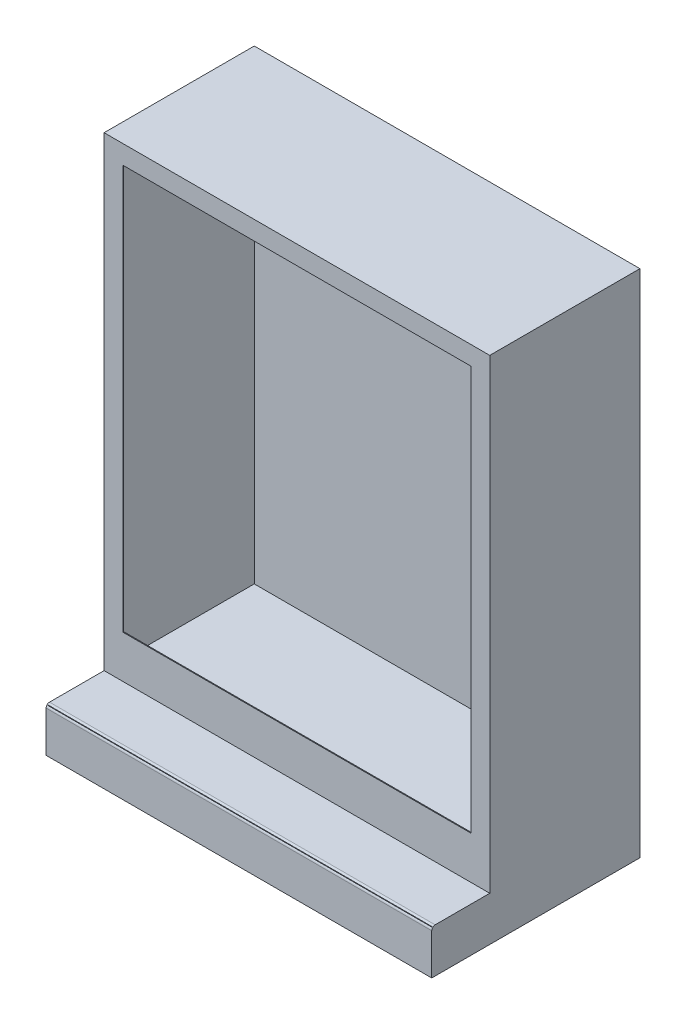
from build123d import *

# Parameters (mm, degrees)
SKETCH1_W           = 279.4
SKETCH1_H           = 866.775
BOSS_EXTRUDE1_DEPTH = 717.55
SHELL2_START        = 1.5875
SHELL2_OUTLINE_W    = 863.6
SHELL2_OUTLINE_H    = 276.225
SHELL2_DEPTH        = 714.375
SHELL2_START_2      = 34.925
SHELL2_2_OUTLINE_W  = 752.475
SHELL2_2_OUTLINE_H  = 1.5875
SHELL2_2_DEPTH      = 647.7
BOSS_EXTRUDE2_DEPTH = 717.55
SHELL3_START        = -385.7625
SHELL3_OUTLINE_W    = 714.375
SHELL3_OUTLINE_H    = 79.375
SHELL3_DEPTH        = 384.175
SHELL3_START_2      = -368.3
SHELL3_2_OUTLINE_W  = 714.375
SHELL3_2_OUTLINE_H  = 1.5875
SHELL3_2_DEPTH      = 258.7625
SHELL3_START_3      = -109.5375
SHELL3_3_OUTLINE_W  = 714.375
SHELL3_3_OUTLINE_H  = 1.5875
SHELL3_3_DEPTH      = 90.4875
SHELL3_4_OUTLINE_W  = 714.375
SHELL3_4_OUTLINE_H  = 1.5875
SHELL3_4_DEPTH      = 17.4625
FILLET1_R           = 6.35
SKETCH6_W           = 41.275
SKETCH6_H           = 387.35
BOSS_EXTRUDE3_DEPTH = 11.1125
SKETCH8_W           = 38.1
SKETCH8_H           = 384.175
CUT_EXTRUDE1_DEPTH  = 9.525
BOSS_EXTRUDE6_REACH = 1252.544


# Read off the part's stored shape, not the designer's step: Shell2, Shell3
with BuildPart() as part:
    # Sketch1 → Boss-Extrude1 (new body)
    with BuildSketch(Plane(origin=(0, 0, 0), x_dir=(0, 0, -1), z_dir=(1, 0, 0))):
        with Locations((247.65, 515.9375)):
            Rectangle(SKETCH1_W, SKETCH1_H)
    extrude(amount=BOSS_EXTRUDE1_DEPTH)

    # Shell2 outline → Shell2 (cut)
    with BuildSketch(Plane.YZ.offset(SHELL2_START)):
        with Locations((515.9375, -247.65)):
            Rectangle(SHELL2_OUTLINE_W, SHELL2_OUTLINE_H)
    extrude(amount=SHELL2_DEPTH, mode=Mode.SUBTRACT)

    # Shell2 2 outline → Shell2 2 (cut)
    with BuildSketch(Plane.YZ.offset(SHELL2_START_2)):
        with Locations((538.1625, -108.74375)):
            Rectangle(SHELL2_2_OUTLINE_W, SHELL2_2_OUTLINE_H)
    extrude(amount=SHELL2_2_DEPTH, mode=Mode.SUBTRACT)

    # Sketch4 → Boss-Extrude2 (add)
    with BuildSketch(Plane(origin=(0, 0, 0), x_dir=(0, 0, -1), z_dir=(1, 0, 0))):
        Polygon((0, 0), (0, 82.55), (107.95, 82.55), (387.35, 82.55), (387.35, 0), align=None)
    extrude(amount=BOSS_EXTRUDE2_DEPTH)

    # Shell3 outline → Shell3 (cut)
    with BuildSketch(Plane.XY.offset(SHELL3_START)):
        with Locations((358.775, 41.275)):
            Rectangle(SHELL3_OUTLINE_W, SHELL3_OUTLINE_H)
    extrude(amount=SHELL3_DEPTH, mode=Mode.SUBTRACT)

    # Shell3 2 outline → Shell3 2 (cut)
    with BuildSketch(Plane.XY.offset(SHELL3_START_2)):
        with Locations((358.775, 0.79375)):
            Rectangle(SHELL3_2_OUTLINE_W, SHELL3_2_OUTLINE_H)
        with Locations((358.775, 81.75625)):
            Rectangle(SHELL3_2_OUTLINE_W, SHELL3_2_OUTLINE_H)
    extrude(amount=SHELL3_2_DEPTH, mode=Mode.SUBTRACT)

    # Shell3 3 outline → Shell3 3 (cut)
    with BuildSketch(Plane.XY.offset(SHELL3_START_3)):
        with Locations((358.775, 0.79375)):
            Rectangle(SHELL3_3_OUTLINE_W, SHELL3_3_OUTLINE_H)
    extrude(amount=SHELL3_3_DEPTH, mode=Mode.SUBTRACT)

    # Shell3 4 outline → Shell3 4 (cut)
    with BuildSketch(Plane.XY.offset(SHELL3_START)):
        with Locations((358.775, 81.75625)):
            Rectangle(SHELL3_4_OUTLINE_W, SHELL3_4_OUTLINE_H)
    extrude(amount=SHELL3_4_DEPTH, mode=Mode.SUBTRACT)

    # Fillet1
    fillet1_edges = [part.edges().sort_by_distance(p)[0] for p in [
        (358.775, 82.55, 0),
    ]]
    fillet(fillet1_edges, radius=FILLET1_R)

    # Sketch6 → Boss-Extrude3 (add)
    with BuildSketch(Plane(origin=(0, 0, 0), x_dir=(1, 0, 0), z_dir=(0, 1, 0))):
        with Locations((123.825, 193.675)):
            Rectangle(SKETCH6_W, SKETCH6_H)
        with Locations((593.725, 193.675)):
            Rectangle(SKETCH6_W, SKETCH6_H)
    extrude(amount=BOSS_EXTRUDE3_DEPTH)

    # Sketch8 → Cut-Extrude1 (cut)
    with BuildSketch(Plane(origin=(0, 11.1125, 0), x_dir=(1, 0, 0), z_dir=(0, 1, 0))):
        with Locations((123.825, 193.675)):
            Rectangle(SKETCH8_W, SKETCH8_H)
        with Locations((593.725, 193.675)):
            Rectangle(SKETCH8_W, SKETCH8_H)
    extrude(amount=-CUT_EXTRUDE1_DEPTH, mode=Mode.SUBTRACT)


with BuildPart() as body_2:

    # Sketch9 → Boss-Extrude6 (new, up to next)
    with BuildSketch(Plane(origin=(1.5875, 0, 0), x_dir=(0, 0, -1), z_dir=(1, 0, 0)), mode=Mode.PRIVATE) as boss_extrude6_sk1:
        Polygon((13.825638806, 70.461659548), (77.7875, 11.1125), (377.786099377, 70.461659548), align=None)
    boss_extrude6_tool1 = extrude(boss_extrude6_sk1.sketch, amount=BOSS_EXTRUDE6_REACH, mode=Mode.PRIVATE) - part.part
    add(boss_extrude6_tool1.solids().sort_by_distance((1.5875, 50.678606, -156.466413))[0])


solid = Compound([part.part, body_2.part])
